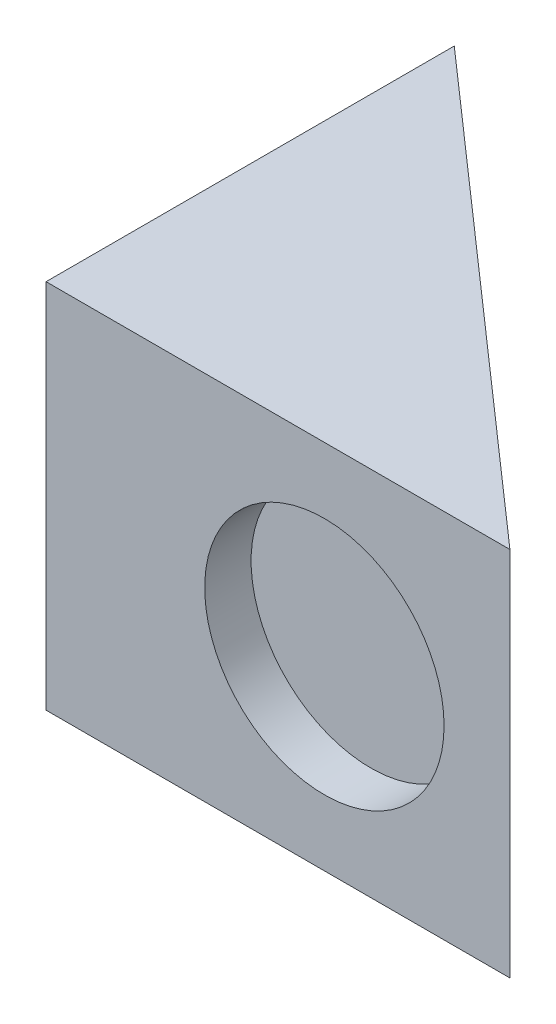
from build123d import *

# Parameters (mm, degrees)
BOSS_EXTRUDE1_DEPTH = 25.4
SKETCH2_R           = 8.1915
CUT_EXTRUDE1_DEPTH  = 3.175
SKETCH3_R           = 8.1915
CUT_EXTRUDE2_DEPTH  = 3.175
SKETCH4_R           = 5.0165
CUT_EXTRUDE3_DEPTH  = 1.6129


with BuildPart() as part:
    # Sketch1 → Boss-Extrude1 (new body)
    with BuildSketch(Plane(origin=(0, 0, 0), x_dir=(1, 0, 0), z_dir=(0, 1, 0))):
        Polygon((0, 0), (0, 27.94), (31.75, 0), align=None)
    extrude(amount=BOSS_EXTRUDE1_DEPTH)

    # Sketch2 → Cut-Extrude1 (cut)
    with BuildSketch(Plane.XY):
        with Locations((19.05, 12.7)):
            Circle(SKETCH2_R)
    extrude(amount=-CUT_EXTRUDE1_DEPTH, mode=Mode.SUBTRACT)

    # Sketch3 → Cut-Extrude2 (cut)
    with BuildSketch(Plane.ZY):
        with Locations((-9.652, 15.748)):
            Circle(SKETCH3_R)
    extrude(amount=-CUT_EXTRUDE2_DEPTH, mode=Mode.SUBTRACT)

    # Sketch4 → Cut-Extrude3 (cut)
    with BuildSketch(Plane.ZY):
        with Locations((-20.32, 6.35)):
            Circle(SKETCH4_R)
    extrude(amount=-CUT_EXTRUDE3_DEPTH, mode=Mode.SUBTRACT)


solid = part.part
